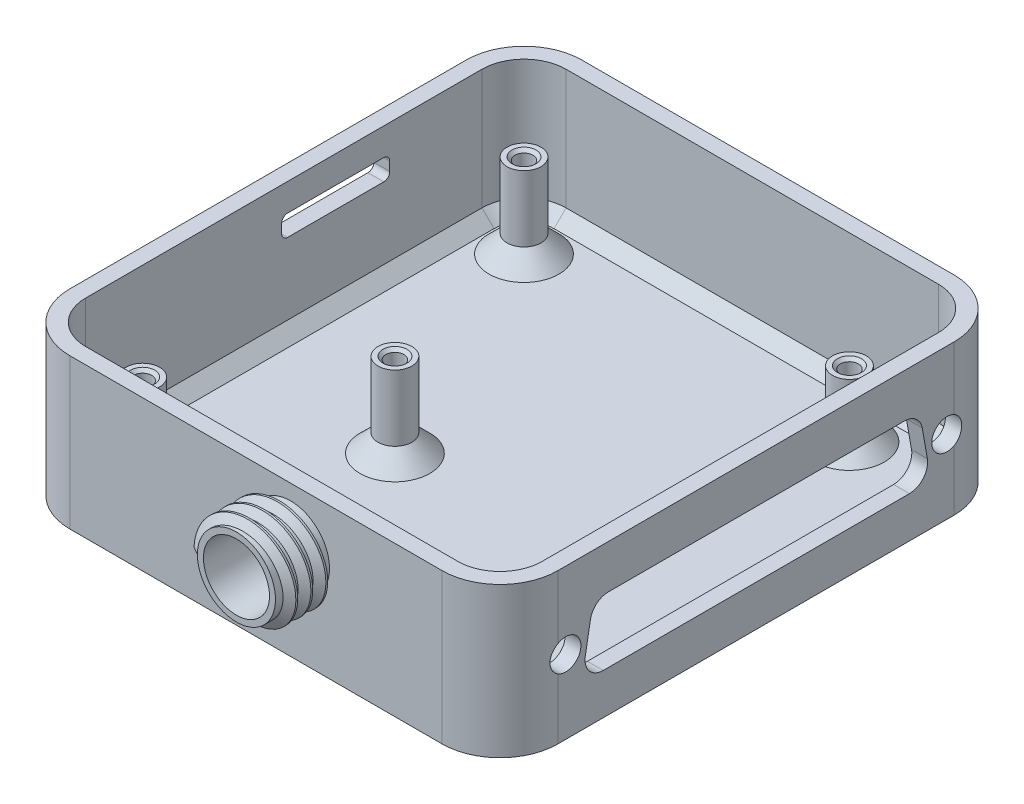
from build123d import *

# Parameters (mm, degrees)
SKETCH1_R                    = 1.5
BASE_EXTRUDE_DEPTH           = 3
WALL_EXTRUDE_DEPTH           = 25
BASE_CHAMFER_SIZE            = 2
SKETCH2_R                    = 2.82
SKETCH2_R_2                  = 1.5
SMALL_PEG_EXTRUDE_DEPTH      = 14
SKETCH3_R                    = 2.82
SKETCH3_R_2                  = 1.5
DSUB_PEG_EXTRUDE_DEPTH       = 11
PEG_CHAMFER_1_SIZE           = 3
PEG_CHAMFER_2_SIZE           = 0.5
SKETCH4_R                    = 5.5
SMA_CUT_EXTRUDE_DEPTH        = 2.64
DSUB_CUT_EXTRUDE_START       = -2.769629
DSUB_CUT_EXTRUDE_DEPTH       = 2.769629
SD_CARD_CUT_EXTRUDE_DEPTH    = 2.64
DSUB_OFFSET_CUT_EXRUDE_START = -2.64
DSUB_OFFSET_CUT_EXRUDE_DEPTH = 2.64
SMA_COVER_EXTRUDE_START      = 9
SKETCH8_R                    = 6.5
SKETCH8_R_2                  = 5.5
SMA_COVER_EXTRUDE_DEPTH      = 9
SMA_COVER_THREAD_PITCH       = 2.5
SMA_COVER_FILLET_R           = 2


with BuildPart() as part:
    # Sketch1 → Base_Extrude (new body)
    with BuildSketch(Plane(origin=(0, 0, 0), x_dir=(1, 0, 0), z_dir=(0, 1, 0))):
        with BuildLine():
            Line((-28.25, -42.74), (33.75, -42.74))
            ThreePointArc((33.75, -42.74), (40.566509371, -39.916509371), (43.39, -33.1))
            Line((43.39, -33.1), (43.39, 32.9))
            ThreePointArc((43.39, 32.9), (40.566509371, 39.716509371), (33.75, 42.54))
            Line((33.75, 42.54), (-28.25, 42.54))
            ThreePointArc((-28.25, 42.54), (-35.066509371, 39.716509371), (-37.89, 32.9))
            Line((-37.89, 32.9), (-37.89, -33.1))
            ThreePointArc((-37.89, -33.1), (-35.066509371, -39.916509371), (-28.25, -42.74))
        make_face()
        with Locations(Location((27.1, -31.75, 0), (0, 0, 270))):
            Circle(SKETCH1_R, mode=Mode.SUBTRACT)
        with Locations(Location((-27.1, -31.75, 0), (0, 0, 270))):
            Circle(SKETCH1_R, mode=Mode.SUBTRACT)
        with Locations(Location((-9.1, -7.75, 0), (0, 0, 270))):
            Circle(SKETCH1_R, mode=Mode.SUBTRACT)
        with Locations(Location((27.1, 31.75, 0), (0, 0, 270))):
            Circle(SKETCH1_R, mode=Mode.SUBTRACT)
        with Locations(Location((-27.1, 31.75, 0), (0, 0, 270))):
            Circle(SKETCH1_R, mode=Mode.SUBTRACT)
    extrude(amount=BASE_EXTRUDE_DEPTH)

    # HRDAQ_PCB_Base_Sketch → Wall_Extrude (add)
    with BuildSketch(Plane(origin=(0, 0, 0), x_dir=(1, 0, 0), z_dir=(0, 1, 0))):
        with BuildLine():
            Line((-37.89, 32.9), (-37.89, -33.1))
            ThreePointArc((-37.89, -33.1), (-35.066509371, -39.916509371), (-28.25, -42.74))
            Line((-28.25, -42.74), (33.75, -42.74))
            ThreePointArc((33.75, -42.74), (40.566509371, -39.916509371), (43.39, -33.1))
            Line((43.39, -33.1), (43.39, 32.9))
            ThreePointArc((43.39, 32.9), (40.566509371, 39.716509371), (33.75, 42.54))
            Line((33.75, 42.54), (-28.25, 42.54))
            ThreePointArc((-28.25, 42.54), (-35.066509371, 39.716509371), (-37.89, 32.9))
        make_face()
        with BuildLine():
            Line((-28.25, -40.1), (33.75, -40.1))
            ThreePointArc((33.75, -40.1), (38.699747468, -38.049747468), (40.75, -33.1))
            Line((40.75, -33.1), (40.75, 32.9))
            ThreePointArc((40.75, 32.9), (38.699747468, 37.849747468), (33.75, 39.9))
            Line((33.75, 39.9), (-28.25, 39.9))
            ThreePointArc((-28.25, 39.9), (-33.199747468, 37.849747468), (-35.25, 32.9))
            Line((-35.25, 32.9), (-35.25, -33.1))
            ThreePointArc((-35.25, -33.1), (-33.199747468, -38.049747468), (-28.25, -40.1))
        make_face(mode=Mode.SUBTRACT)
    extrude(amount=WALL_EXTRUDE_DEPTH)

    # Base_Chamfer
    base_chamfer_edges = [part.edges().sort_by_distance(p)[0] for p in [
        (-33.199747468, 3, -37.849747468),
        (-35.25, 3, 0.1),
        (-33.199747468, 3, 38.049747468),
        (2.75, 3, 40.1),
        (38.699747468, 3, 38.049747468),
        (40.75, 3, 0.1),
        (38.699747468, 3, -37.849747468),
        (2.75, 3, -39.9),
    ]]
    chamfer(base_chamfer_edges, length=BASE_CHAMFER_SIZE)

    # Sketch2 → Small_Peg_Extrude (add)
    # profile 1 of 3: a face of its own
    with BuildSketch(Plane(origin=(0, 3, 0), x_dir=(1, 0, 0), z_dir=(0, 1, 0))):
        with Locations(Location((-27.1, 31.75, 0), (0, 0, 270))):
            Circle(SKETCH2_R)
        with Locations(Location((-27.1, 31.75, 0), (0, 0, 270))):
            Circle(SKETCH2_R_2, mode=Mode.SUBTRACT)
    # profile 2 of 3: a face of its own
    with BuildSketch(Plane(origin=(0, 3, 0), x_dir=(1, 0, 0), z_dir=(0, 1, 0))):
        with Locations(Location((-9.1, -7.75, 0), (0, 0, 270))):
            Circle(SKETCH2_R)
        with Locations(Location((-9.1, -7.75, 0), (0, 0, 270))):
            Circle(SKETCH2_R_2, mode=Mode.SUBTRACT)
    # profile 3 of 3: a face of its own
    with BuildSketch(Plane(origin=(0, 3, 0), x_dir=(1, 0, 0), z_dir=(0, 1, 0))):
        with Locations(Location((-27.1, -31.75, 0), (0, 0, 270))):
            Circle(SKETCH2_R)
        with Locations(Location((-27.1, -31.75, 0), (0, 0, 270))):
            Circle(SKETCH2_R_2, mode=Mode.SUBTRACT)
    extrude(amount=SMALL_PEG_EXTRUDE_DEPTH)

    # Sketch3 → DSUB_Peg_Extrude (add)
    # profile 1 of 2: a face of its own
    with BuildSketch(Plane(origin=(0, 3, 0), x_dir=(1, 0, 0), z_dir=(0, 1, 0))):
        with Locations(Location((27.1, 31.75, 0), (0, 0, 270))):
            Circle(SKETCH3_R)
        with Locations(Location((27.1, 31.75, 0), (0, 0, 270))):
            Circle(SKETCH3_R_2, mode=Mode.SUBTRACT)
    # profile 2 of 2: a face of its own
    with BuildSketch(Plane(origin=(0, 3, 0), x_dir=(1, 0, 0), z_dir=(0, 1, 0))):
        with Locations(Location((27.1, -31.75, 0), (0, 0, 270))):
            Circle(SKETCH3_R)
        with Locations(Location((27.1, -31.75, 0), (0, 0, 270))):
            Circle(SKETCH3_R_2, mode=Mode.SUBTRACT)
    extrude(amount=DSUB_PEG_EXTRUDE_DEPTH)

    # Peg_Chamfer_1
    peg_chamfer_1_edges = [part.edges().sort_by_distance(p)[0] for p in [
        (-27.1, 3, -34.57),
        (-9.1, 3, 4.93),
        (-27.1, 3, 28.93),
        (27.1, 3, -34.57),
        (27.1, 3, 28.93),
    ]]
    chamfer(peg_chamfer_1_edges, length=PEG_CHAMFER_1_SIZE)

    # Peg_Chamfer_2
    peg_chamfer_2_edges = [part.edges().sort_by_distance(p)[0] for p in [
        (-27.1, 17, -33.25),
        (-9.1, 17, 6.25),
        (-27.1, 17, 30.25),
        (27.1, 14, -33.25),
        (27.1, 14, 30.25),
    ]]
    chamfer(peg_chamfer_2_edges, length=PEG_CHAMFER_2_SIZE)

    # Sketch4 → SMA_Cut_Extrude (cut)
    with BuildSketch(Plane.XY.offset(42.74)):
        with Locations((8.5, 15.95)):
            Circle(SKETCH4_R)
    extrude(amount=-SMA_CUT_EXTRUDE_DEPTH, mode=Mode.SUBTRACT)

    # Sketch5 → DSUB_Cut_Extrude (cut)
    with BuildSketch(Plane(origin=(43.39, 0, 0), x_dir=(0, 0, -1), z_dir=(1, 0, 0)).offset(DSUB_CUT_EXTRUDE_START)):
        with BuildLine():
            ThreePointArc((-27.547890854, 10.211353097), (-27.103363808, 8.552355577), (-25.5467615, 7.8265))
            Line((-25.5467615, 7.8265), (25.449941675, 7.8265))
            ThreePointArc((25.449941675, 7.8265), (27.006174695, 8.551915602), (27.451270202, 10.210221664))
            Line((27.451270202, 10.210221664), (26.601477222, 15.045621664))
            ThreePointArc((26.601477222, 15.045621664), (25.906733094, 16.250133019), (24.600148696, 16.7259))
            Line((24.600148696, 16.7259), (-24.694150017, 16.7259))
            ThreePointArc((-24.694150017, 16.7259), (-26.00029444, 16.250502308), (-26.695279371, 15.046753097))
            Line((-26.695279371, 15.046753097), (-27.547890854, 10.211353097))
        make_face()
        with BuildLine():
            Line((-33.1, 14.457775504), (-33.1, 10.094624496))
            ThreePointArc((-33.1, 10.094624496), (-30.544647509, 10.067594806), (-29.2591048, 12.2762))
            ThreePointArc((-29.2591048, 12.2762), (-30.544647509, 14.484805194), (-33.1, 14.457775504))
        make_face()
        with BuildLine():
            ThreePointArc((-33.1, 14.457775504), (-34.3391048, 12.2762), (-33.1, 10.094624496))
            Line((-33.1, 10.094624496), (-33.1, 14.457775504))
        make_face()
        with BuildLine():
            Line((32.9, 14.515339942), (32.9, 10.037060058))
            ThreePointArc((32.9, 10.037060058), (33.880037943, 10.971233754), (34.2408952, 12.2762))
            ThreePointArc((34.2408952, 12.2762), (33.880037943, 13.581166246), (32.9, 14.515339942))
        make_face()
        with BuildLine():
            ThreePointArc((32.9, 14.515339942), (29.1608952, 12.2762), (32.9, 10.037060058))
            Line((32.9, 10.037060058), (32.9, 14.515339942))
        make_face()
    extrude(amount=DSUB_CUT_EXTRUDE_DEPTH, mode=Mode.SUBTRACT)

    # Sketch6 → SD-Card_Cut_Extrude (cut)
    with BuildSketch(Plane.ZY.offset(37.89)):
        with BuildLine():
            Line((-16.54, 20.43), (-0.54, 20.43))
            ThreePointArc((-0.54, 20.43), (0.167106781, 20.137106781), (0.46, 19.43))
            Line((0.46, 19.43), (0.46, 17.93))
            ThreePointArc((0.46, 17.93), (0.167106781, 17.222893219), (-0.54, 16.93))
            Line((-0.54, 16.93), (-16.54, 16.93))
            ThreePointArc((-16.54, 16.93), (-17.247106781, 17.222893219), (-17.54, 17.93))
            Line((-17.54, 17.93), (-17.54, 19.43))
            ThreePointArc((-17.54, 19.43), (-17.247106781, 20.137106781), (-16.54, 20.43))
        make_face()
    extrude(amount=-SD_CARD_CUT_EXTRUDE_DEPTH, mode=Mode.SUBTRACT)

    # Sketch7 → DSUB_OFFSET_Cut_Exrude (cut)
    with BuildSketch(Plane(origin=(43.39, 0, 0), x_dir=(0, 0, -1), z_dir=(1, 0, 0)).offset(DSUB_OFFSET_CUT_EXRUDE_START)):
        with BuildLine():
            Line((-24.694150017, 17.7259), (24.600148696, 17.7259))
            ThreePointArc((24.600148696, 17.7259), (26.549737227, 17.015995726), (27.586382993, 15.218713033))
            Line((27.586382993, 15.218713033), (28.436175973, 10.383313033))
            ThreePointArc((28.436175973, 10.383313033), (27.772037401, 7.908911469), (25.449941675, 6.8265))
            Line((25.449941675, 6.8265), (-25.5467615, 6.8265))
            ThreePointArc((-25.5467615, 6.8265), (-27.869408251, 7.909567967), (-28.532698607, 10.385001275))
            Line((-28.532698607, 10.385001275), (-27.680087124, 15.220401275))
            ThreePointArc((-27.680087124, 15.220401275), (-26.64308205, 17.016546752), (-24.694150017, 17.7259))
        make_face()
        with BuildLine():
            Line((-27.547890854, 10.211353097), (-26.695279371, 15.046753097))
            ThreePointArc((-26.695279371, 15.046753097), (-26.00029444, 16.250502308), (-24.694150017, 16.7259))
            Line((-24.694150017, 16.7259), (24.600148696, 16.7259))
            ThreePointArc((24.600148696, 16.7259), (25.906733094, 16.250133019), (26.601477222, 15.045621664))
            Line((26.601477222, 15.045621664), (27.451270202, 10.210221664))
            ThreePointArc((27.451270202, 10.210221664), (27.006174695, 8.551915602), (25.449941675, 7.8265))
            Line((25.449941675, 7.8265), (-25.5467615, 7.8265))
            ThreePointArc((-25.5467615, 7.8265), (-27.103363808, 8.552355577), (-27.547890854, 10.211353097))
        make_face(mode=Mode.SUBTRACT)
    extrude(amount=DSUB_OFFSET_CUT_EXRUDE_DEPTH, mode=Mode.SUBTRACT)

    # Sketch8 → SMA_Cover_Extrude (add)
    with BuildSketch(Plane.XY.offset(42.74).offset(SMA_COVER_EXTRUDE_START)):
        with Locations(Location((8.5, 15.95, 0), (0, 0, 180))):
            Circle(SKETCH8_R)
        with Locations((8.5, 15.95)):
            Circle(SKETCH8_R_2, mode=Mode.SUBTRACT)
    extrude(amount=-SMA_COVER_EXTRUDE_DEPTH)

    # SMA_Cover_Thread: the profile of Thread Profile1 profile screwed along a right-hand helix of 3 turns, 10 arcs to a turn; built about Z, then put on its axis
    sma_cover_thread_z = Axis((0, 0, 0), (0, 0, 1))
    sma_cover_thread_corners = [(6.4997, 0, -0.000173205), (7.853164688, 0, 0.781249997), (7.853164688, 0, 1.093749997), (6.4997, 0, 1.875173198)]
    with BuildLine(mode=Mode.PRIVATE) as sma_cover_thread_profile:
        Line(sma_cover_thread_corners[0], sma_cover_thread_corners[1])
        Line(sma_cover_thread_corners[1], sma_cover_thread_corners[2])
        Line(sma_cover_thread_corners[2], sma_cover_thread_corners[3])
        Line(sma_cover_thread_corners[3], sma_cover_thread_corners[0])
    sma_cover_thread_cap = Face(sma_cover_thread_profile.wire())
    sma_cover_thread_turn_angles = [0, 18, 36, 54, 72, 90, 108, 126, 144, 162, 180, 198, 216, 234, 252, 270, 288, 306, 324, 342, 360]
    sma_cover_thread_turn_weights = [1, 0.9510565162951535, 1, 0.9510565162951535, 1, 0.9510565162951535, 1, 0.9510565162951535, 1, 0.9510565162951535, 1, 0.9510565162951535, 1, 0.9510565162951535, 1, 0.9510565162951535, 1, 0.9510565162951535, 1, 0.9510565162951535, 1]
    sma_cover_thread_turn_rails = [Edge.make_bspline([Vector(p[0], p[1], 0).rotate(sma_cover_thread_z, sma_cover_thread_turn_angles[k]) / sma_cover_thread_turn_weights[k] + Vector(0, 0, p[2] + SMA_COVER_THREAD_PITCH * sma_cover_thread_turn_angles[k] / 360) for k in range(21)], [0, 0, 0, 1, 1, 2, 2, 3, 3, 4, 4, 5, 5, 6, 6, 7, 7, 8, 8, 9, 9, 10, 10, 10], 2, sma_cover_thread_turn_weights) for p in sma_cover_thread_corners]
    sma_cover_thread_turn_sides = [Face.make_surface_from_curves(sma_cover_thread_turn_rails[p[0]], sma_cover_thread_turn_rails[p[1]]) for p in [(0, 1), (1, 2), (2, 3), (3, 0)]]
    sma_cover_thread = Plane(origin=(8.5, 15.95, 51.74), x_dir=(-1, 0, 0), z_dir=(0, 0, -1)) * Solid(Shell([*[p.moved(Location((0, 0, SMA_COVER_THREAD_PITCH * i))) for i in range(3) for p in sma_cover_thread_turn_sides], sma_cover_thread_cap, sma_cover_thread_cap.rotate(sma_cover_thread_z, 1080).moved(Location((0, 0, SMA_COVER_THREAD_PITCH * 1080 / 360)))]))
    add(sma_cover_thread)

    # SMA_Cover_Fillet
    sma_cover_fillet_edges = [part.edges().sort_by_distance(p)[0] for p in [
        (3, 15.95, 40.1),
    ]]
    fillet(sma_cover_fillet_edges, radius=SMA_COVER_FILLET_R)


solid = part.part
